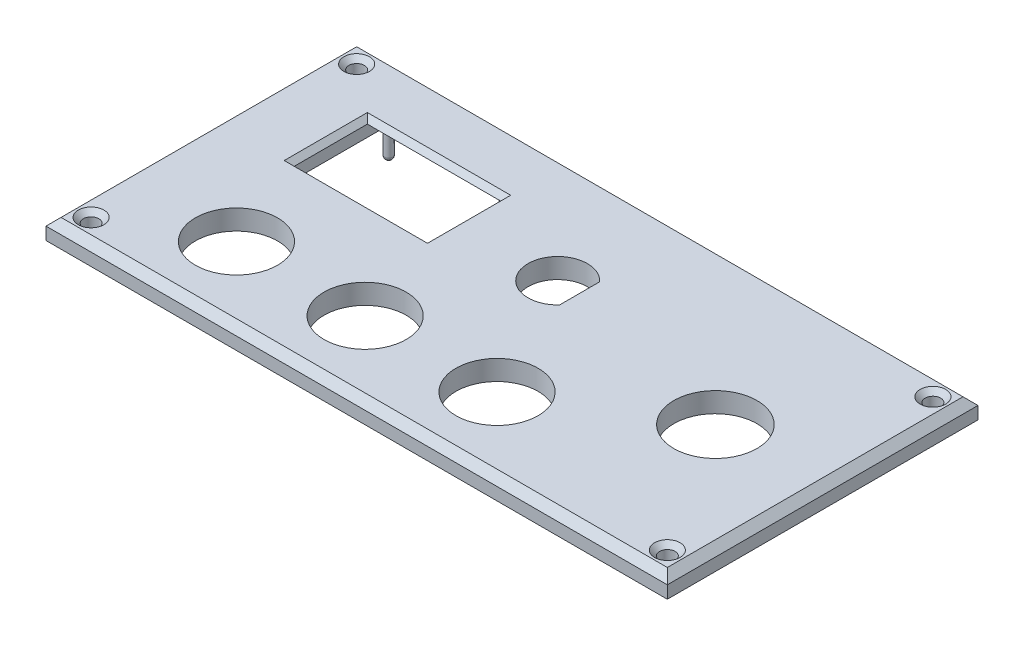
from build123d import *

# Parameters (mm, degrees)
SKETCH2_W           = 124
SKETCH2_H           = 62
SKETCH2_R           = 1.55
SKETCH2_W_2         = 26.6
SKETCH2_H_2         = 14.6
SKETCH2_R_2         = 8.3
SKETCH2_R_3         = 8.2
BOSS_EXTRUDE1_DEPTH = 4
CHAMFER1_SIZE       = 1.5
CHAMFER2_SIZE       = 1
SKETCH2_3_R         = 0.8
BOSS_EXTRUDE2_DEPTH = 3.5
FILLET1_R           = 0.8
CUT_EXTRUDE1_START  = 3
SKETCH2_4_W         = 28
SKETCH2_4_H         = 28.35
SKETCH2_4_R         = 0.8
SKETCH2_4_W_2       = 26.6
SKETCH2_4_H_2       = 14.6
CUT_EXTRUDE1_DEPTH  = 3
CHAMFER3_SIZE       = 1


with BuildPart() as part:
    # Sketch2 → Boss-Extrude1 (new body)
    with BuildSketch(Plane(origin=(0, 0, 0), x_dir=(1, 0, 0), z_dir=(0, 1, 0))):
        with Locations((62, 31)):
            Rectangle(SKETCH2_W, SKETCH2_H)
        with Locations(Location((4.5, 4.5, 0), (0, 0, 270))):
            Circle(SKETCH2_R, mode=Mode.SUBTRACT)
        with Locations(Location((119.5, 4.5, 0), (0, 0, 270))):
            Circle(SKETCH2_R, mode=Mode.SUBTRACT)
        with Locations(Location((4.5, 57.5, 0), (0, 0, 270))):
            Circle(SKETCH2_R, mode=Mode.SUBTRACT)
        with Locations(Location((119.5, 57.5, 0), (0, 0, 270))):
            Circle(SKETCH2_R, mode=Mode.SUBTRACT)
        with Locations((28.239743387, 41.89740921)):
            Rectangle(SKETCH2_W_2, SKETCH2_H_2, mode=Mode.SUBTRACT)
        with Locations(Location((102.593331931, 31, 0), (0, 0, 270))):
            Circle(SKETCH2_R_2, mode=Mode.SUBTRACT)
        with Locations(Location((75.171087178, 14.839562505, 0), (0, 0, 270))):
            Circle(SKETCH2_R_3, mode=Mode.SUBTRACT)
        with BuildLine():
            ThreePointArc((66.375, 36.123659504), (56.075, 40.119282109), (66.375, 44.114904714))
            Line((66.375, 44.114904714), (66.375, 36.123659504))
        make_face(mode=Mode.SUBTRACT)
        with Locations(Location((48.846547615, 14.839562505, 0), (0, 0, 270))):
            Circle(SKETCH2_R_3, mode=Mode.SUBTRACT)
        with Locations(Location((23.171087178, 14.839562505, 0), (0, 0, 270))):
            Circle(SKETCH2_R_3, mode=Mode.SUBTRACT)
    extrude(amount=BOSS_EXTRUDE1_DEPTH)

    # Chamfer1
    chamfer1_edges = [part.edges().sort_by_distance(p)[0] for p in [
        (62, 4, 0),
        (124, 4, -31),
        (62, 4, -62),
        (0, 4, -31),
    ]]
    chamfer(chamfer1_edges, length=CHAMFER1_SIZE)

    # Chamfer2
    chamfer2_edges = [part.edges().sort_by_distance(p)[0] for p in [
        (119.5, 0, -59.05),
        (4.5, 4, -6.05),
        (119.5, 4, -59.05),
        (119.5, 4, -6.05),
        (4.5, 4, -59.05),
    ]]
    chamfer(chamfer2_edges, length=CHAMFER2_SIZE)

    # Sketch2<3> → Boss-Extrude2 (add)
    with BuildSketch(Plane(origin=(0, 0, 0), x_dir=(1, 0, 0), z_dir=(0, 1, 0))):
        with Locations(Location((16.679743387, 28.409287577, 0), (0, 0, 270))):
            Circle(SKETCH2_3_R)
        with Locations(Location((16.679743387, 51.709287577, 0), (0, 0, 270))):
            Circle(SKETCH2_3_R)
        with Locations(Location((39.799743387, 28.409287577, 0), (0, 0, 270))):
            Circle(SKETCH2_3_R)
        with Locations(Location((39.799743387, 51.709287577, 0), (0, 0, 270))):
            Circle(SKETCH2_3_R)
    extrude(amount=-BOSS_EXTRUDE2_DEPTH)

    # Fillet1
    fillet1_edges = [part.edges().sort_by_distance(p)[0] for p in [
        (39.799743387, -3.5, -29.209287577),
        (39.799743387, -3.5, -52.509287577),
        (16.679743387, -3.5, -29.209287577),
        (16.679743387, -3.5, -52.509287577),
    ]]
    fillet(fillet1_edges, radius=FILLET1_R)

    # Sketch2<4> → Cut-Extrude1 (cut)
    with BuildSketch(Plane(origin=(0, 0, 0), x_dir=(1, 0, 0), z_dir=(0, 1, 0)).offset(CUT_EXTRUDE1_START)):
        with Locations((28.239743387, 39.62240921)):
            Rectangle(SKETCH2_4_W, SKETCH2_4_H)
        with Locations(Location((16.679743387, 51.709287577, 0), (0, 0, 270))):
            Circle(SKETCH2_4_R, mode=Mode.SUBTRACT)
        with Locations(Location((16.679743387, 28.409287577, 0), (0, 0, 270))):
            Circle(SKETCH2_4_R, mode=Mode.SUBTRACT)
        with Locations(Location((39.799743387, 28.409287577, 0), (0, 0, 270))):
            Circle(SKETCH2_4_R, mode=Mode.SUBTRACT)
        with Locations(Location((39.799743387, 51.709287577, 0), (0, 0, 270))):
            Circle(SKETCH2_4_R, mode=Mode.SUBTRACT)
        with Locations((28.239743387, 41.89740921)):
            Rectangle(SKETCH2_4_W_2, SKETCH2_4_H_2, mode=Mode.SUBTRACT)
    extrude(amount=-CUT_EXTRUDE1_DEPTH, mode=Mode.SUBTRACT)

    # Chamfer3
    chamfer3_edges = [part.edges().sort_by_distance(p)[0] for p in [
        (28.239743387, 4, -34.59740921),
        (41.539743387, 4, -41.89740921),
        (14.939743387, 4, -41.89740921),
        (28.239743387, 4, -49.19740921),
    ]]
    chamfer(chamfer3_edges, length=CHAMFER3_SIZE - 0.0001)  # a hair under: the kernel refuses the full size


solid = part.part
